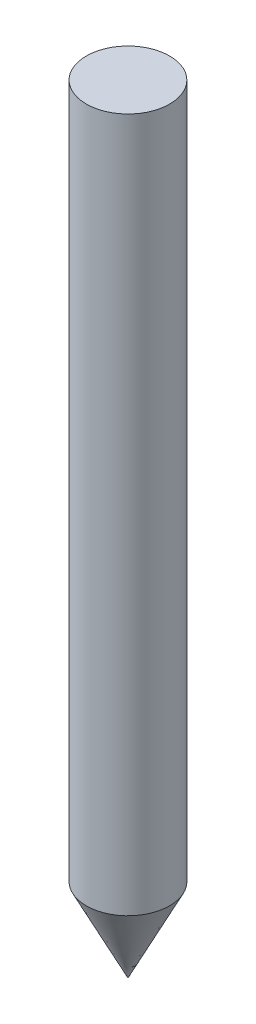
from build123d import *

# Parameters (mm, degrees)
SKETCH_1_R      = 3
EXTRUDE_1_DEPTH = 50


# Read off the part's stored shape, not the designer's step: 放样1
with BuildPart() as part:
    # 草图1 → 凸台-拉伸1 (new body)
    with BuildSketch(Plane(origin=(0, 6, 0), x_dir=(1, 0, 0), z_dir=(0, 1, 0))):
        with Locations(Location((0, 0, 0), (0, 0, 270))):
            Circle(SKETCH_1_R)
    extrude(amount=EXTRUDE_1_DEPTH)

    # 放样1 outline → 放样1 (revolve)
    with BuildSketch(Plane.XY):
        Polygon((0, 6), (0, 0), (3, 6), align=None)
    revolve(axis=Axis((0, 0, 0), (0, 1, 0)))


solid = part.part
